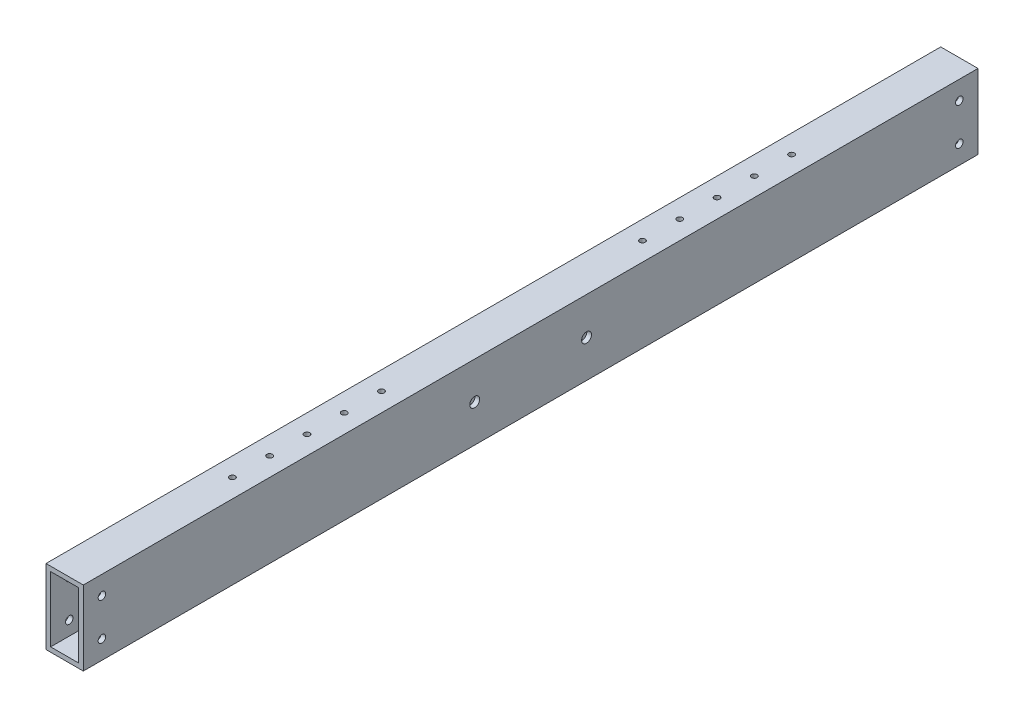
from build123d import *

# Parameters (mm, degrees)
SKETCH1_W               = 25.4
SKETCH1_H               = 50.8
SKETCH1_W_2             = 19.05
SKETCH1_H_2             = 44.45
BOSS_EXTRUDE1_DEPTH     = 304.8
F_10_CLEARANCE_HOLE1_D  = 5.1054
F_1_4_CLEARANCE_HOLE2_D = 6.7564
SKETCH7_R               = 1.905
CUT_EXTRUDE1_DEPTH      = 310.265209812


with BuildPart() as part:
    # Sketch1 → Boss-Extrude1 (new, symmetric)
    with BuildSketch(Plane.XY):
        Rectangle(SKETCH1_W, SKETCH1_H)
        Rectangle(SKETCH1_W_2, SKETCH1_H_2, mode=Mode.SUBTRACT)
    extrude(amount=BOSS_EXTRUDE1_DEPTH, both=True)

    # #10 Clearance Hole1 (through all)
    with Locations(Plane(origin=(12.7, 0, 0), x_dir=(0, 0, -1), z_dir=(1, 0, 0))):
        with Locations((-292.1, 12.7), (-292.1, -12.7)):
            f_10_clearance_hole1 = Hole(F_10_CLEARANCE_HOLE1_D / 2)

    # Mirror1: #10 Clearance Hole1 across plane
    add(f_10_clearance_hole1.mirror(Plane.XY), mode=Mode.SUBTRACT)

    # 1/4 Clearance Hole2 (through all)
    with Locations(Plane(origin=(12.7, 0, 0), x_dir=(0, 0, -1), z_dir=(1, 0, 0))):
        with Locations((-38.1, 0), (38.1, 0)):
            Hole(F_1_4_CLEARANCE_HOLE2_D / 2)

    # Sketch7 → Cut-Extrude1 (cut, through all)
    with BuildSketch(Plane(origin=(0, 25.4, 0), x_dir=(1, 0, 0), z_dir=(0, 1, 0))):
        with Locations((0, 190.5)):
            Circle(SKETCH7_R)
        with Locations((0, 165.1)):
            Circle(SKETCH7_R)
        with Locations((0, 139.7)):
            Circle(SKETCH7_R)
        with Locations((0, 114.3)):
            Circle(SKETCH7_R)
        with Locations((0, 88.9)):
            Circle(SKETCH7_R)
    cut_extrude1 = extrude(amount=-CUT_EXTRUDE1_DEPTH, mode=Mode.SUBTRACT)

    # Mirror2: Cut-Extrude1 across plane
    add(cut_extrude1.mirror(Plane.XY), mode=Mode.SUBTRACT)


solid = part.part
